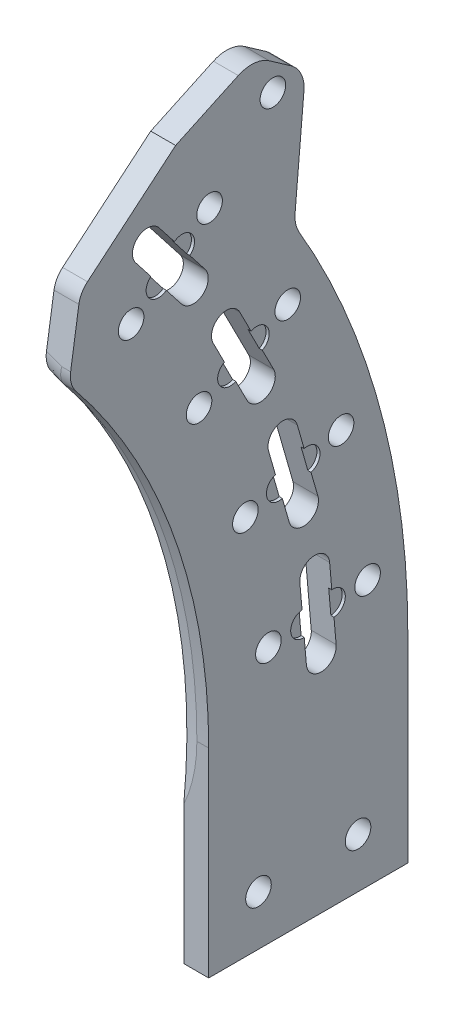
from build123d import *
from build123d.topology import SkipClean

# Parameters (mm, degrees)
SKETCH1_R               = 3.2639
BOSS_EXTRUDE1_DEPTH     = 6.35
FILLET1_R               = 6.35
SKETCH6_R               = 3.2639
CUT_EXTRUDE1_DEPTH      = 246.360186308
CUT_EXTRUDE2_START      = -0.79375
CUT_EXTRUDE2_DEPTH      = 10.82675
CIRPATTERN1_COUNT       = 4
CIRPATTERN1_ANGLE       = 33
BOSS_EXTRUDE2_DEPTH     = 6.35
CUT_EXTRUDE3_DEPTH      = 251.739762675
CUT_EXTRUDE3_DEPTH_BACK = 251.739762675
SKETCH9_R               = 3.2639
FILLET2_R               = 7.9375


with BuildPart() as part:
    # Sketch1 → Boss-Extrude1 (new body)
    with BuildSketch(Plane(origin=(0, 0, 0), x_dir=(0, 0, -1), z_dir=(1, 0, 0))):
        with BuildLine():
            Line((152.4, 0), (152.4, -50.8))
            Line((152.4, -50.8), (203.2, -50.8))
            Line((203.2, -50.8), (203.2, 0))
            ThreePointArc((203.2, 0), (190.945540544, 69.498493124), (155.660230842, 130.614442288))
            Line((155.660230842, 130.614442288), (143.955847531, 137.371971144))
            Line((143.955847531, 137.371971144), (119.633936462, 116.963464536))
            Line((119.633936462, 116.963464536), (116.745173131, 97.960831716))
            ThreePointArc((116.745173131, 97.960831716), (143.209155408, 52.123869843), (152.4, 0))
        make_face()
        with Locations((165.1, -38.1)):
            Circle(SKETCH1_R, mode=Mode.SUBTRACT)
        with Locations((190.5, -38.1)):
            Circle(SKETCH1_R, mode=Mode.SUBTRACT)
    extrude(amount=BOSS_EXTRUDE1_DEPTH)

    # Sketch2 → Cut-Revolve2 (revolve, cut)
    with SkipClean():  # the faces are left unmerged after this step: merging them gives an invalid solid
        with BuildSketch(Plane(origin=(0, 0, 0), x_dir=(1, 0, 0), z_dir=(0, 1, 0))):
            with BuildLine():
                Line((-143.256, 38.1), (-25.4, 38.1))
                Line((-25.4, 38.1), (92.456, 38.1))
                ThreePointArc((92.456, 38.1), (-25.4, 155.956), (-143.256, 38.1))
            make_face()
        revolve(axis=Axis((0, 0, 0), (-1, 0, 0)), mode=Mode.SUBTRACT)
    add(part.part.scale(1), mode=Mode.REPLACE)  # the faces are merged on a copy

    # Fillet1
    fillet1_edges = [part.edges().sort_by_distance(p)[0] for p in [
        (4.841164554, 97.960831716, -116.745173131),
        (1.671163996, 98.49343633, -116.826139211),
        (3.175, 116.963464536, -119.633936462),
        (3.175, 130.614442288, -155.660230842),
    ]]
    fillet(fillet1_edges, radius=FILLET1_R)

    # Sketch6 → Cut-Extrude1 (cut, through all)
    with BuildSketch(Plane(origin=(6.35, 0, 0), x_dir=(0, 0, -1), z_dir=(1, 0, 0))):
        with Locations((167.634662821, 14.666132611)):
            Circle(SKETCH6_R)
        with Locations((192.938008153, 16.879888477)):
            Circle(SKETCH6_R)
        with Locations((161.756311884, 46.38287605)):
            Circle(SKETCH6_R)
        with Locations((186.172358961, 53.384064888)):
            Circle(SKETCH6_R)
        with Locations((149.934122858, 76.395251344)):
            Circle(SKETCH6_R)
        with Locations((172.565688572, 87.926610037)):
            Circle(SKETCH6_R)
        with Locations((132.602509563, 103.60043476)):
            Circle(SKETCH6_R)
        with Locations((152.617982705, 119.238236234)):
            Circle(SKETCH6_R)
        with BuildLine():
            Line((167.676482547, 57.989309797), (172.927374175, 39.67727449))
            ThreePointArc((172.927374175, 39.67727449), (177.639959562, 37.065045754), (180.252188298, 41.777631141))
            Line((180.252188298, 41.777631141), (175.00129667, 60.089666448))
            ThreePointArc((175.00129667, 60.089666448), (170.288711283, 62.701895184), (167.676482547, 57.989309797))
        make_face()
        with BuildLine():
            Line((153.530911348, 88.918064029), (162.179430368, 71.944389743))
            ThreePointArc((162.179430368, 71.944389743), (167.303869029, 70.27935869), (168.968900082, 75.403797351))
            Line((168.968900082, 75.403797351), (160.320381062, 92.377471637))
            ThreePointArc((160.320381062, 92.377471637), (155.195942401, 94.04250269), (153.530911348, 88.918064029))
        make_face()
        with BuildLine():
            Line((175.660675238, 24.929701663), (177.320992137, 5.952192665))
            ThreePointArc((177.320992137, 5.952192665), (181.448557317, 2.488754245), (184.911995737, 6.616319424))
            Line((184.911995737, 6.616319424), (183.251678837, 25.593828423))
            ThreePointArc((183.251678837, 25.593828423), (179.124113658, 29.057266843), (175.660675238, 24.929701663))
        make_face()
        with BuildLine():
            Line((139.748391553, 121.270808146), (151.476742658, 106.25920329))
            ThreePointArc((151.476742658, 106.25920329), (150.820091907, 100.911212098), (145.472100715, 101.567862848))
            Line((145.472100715, 101.567862848), (133.74374961, 116.579467704))
            ThreePointArc((133.74374961, 116.579467704), (134.400400361, 121.927458896), (139.748391553, 121.270808146))
        make_face()
    extrude(amount=-CUT_EXTRUDE1_DEPTH, mode=Mode.SUBTRACT)

    # Sketch8 → Cut-Extrude2 (cut)
    with BuildSketch(Plane(origin=(6.35, 15.551634957, -177.756000954), x_dir=(0, 0.08715574274765883, -0.9961946980917454), z_dir=(1, 0, 0)).offset(CUT_EXTRUDE2_START)):
        with BuildLine():
            Line((6.35, 3.175), (-1.27, 3.175))
            ThreePointArc((-1.27, 3.175), (-4.445, 0), (-1.27, -3.175))
            Line((-1.27, -3.175), (6.35, -3.175))
            ThreePointArc((6.35, -3.175), (9.525, 0), (6.35, 3.175))
        make_face()
    cut_extrude2 = extrude(amount=CUT_EXTRUDE2_DEPTH, mode=Mode.SUBTRACT)

    # CirPattern1: Cut-Extrude2 ×4 about axis
    cirpattern1_axis = Axis((6.35, 0, 0), (1, 0, 0))
    for i in range(1, CIRPATTERN1_COUNT):
        add(cut_extrude2.rotate(cirpattern1_axis, i * CIRPATTERN1_ANGLE / (CIRPATTERN1_COUNT - 1)), mode=Mode.SUBTRACT)

    # Sketch11 → Boss-Extrude2 (add)
    with BuildSketch(Plane(origin=(6.35, 0, 0), x_dir=(0, 0, -1), z_dir=(1, 0, 0))):
        with BuildLine():
            Line((164.098538098, 146.764662011), (143.955847531, 137.371971144))
            Line((143.955847531, 137.371971144), (154.682623198, 131.178864325))
            ThreePointArc((154.682623198, 131.178864325), (155.603036102, 130.532446831), (156.394965882, 129.733783753))
            ThreePointArc((156.394965882, 129.733783753), (165.779619803, 117.504713343), (174.21022582, 104.599413095))
            Line((174.21022582, 104.599413095), (177.102576801, 137.659136084))
            Line((177.102576801, 137.659136084), (164.098538098, 146.764662011))
        make_face()
    extrude(amount=-BOSS_EXTRUDE2_DEPTH)

    # Sketch9 → Cut-Extrude3 (cut, two sides: drawn at the far end of the back side and taken through both)
    with BuildSketch(Plane(origin=(6.35, 0, 0), x_dir=(0, 0, -1), z_dir=(1, 0, 0)).offset(-CUT_EXTRUDE3_DEPTH_BACK)):
        with Locations((168.77278845, 136.669509324)):
            Circle(SKETCH9_R)
    extrude(amount=CUT_EXTRUDE3_DEPTH + CUT_EXTRUDE3_DEPTH_BACK, mode=Mode.SUBTRACT)

    # Fillet2
    fillet2_edges = [part.edges().sort_by_distance(p)[0] for p in [
        (3.175, 137.659136084, -177.102576801),
        (3.175, 146.764662011, -164.098538098),
        (3.175, 104.599413095, -174.21022582),
    ]]
    fillet(fillet2_edges, radius=FILLET2_R)


solid = part.part
